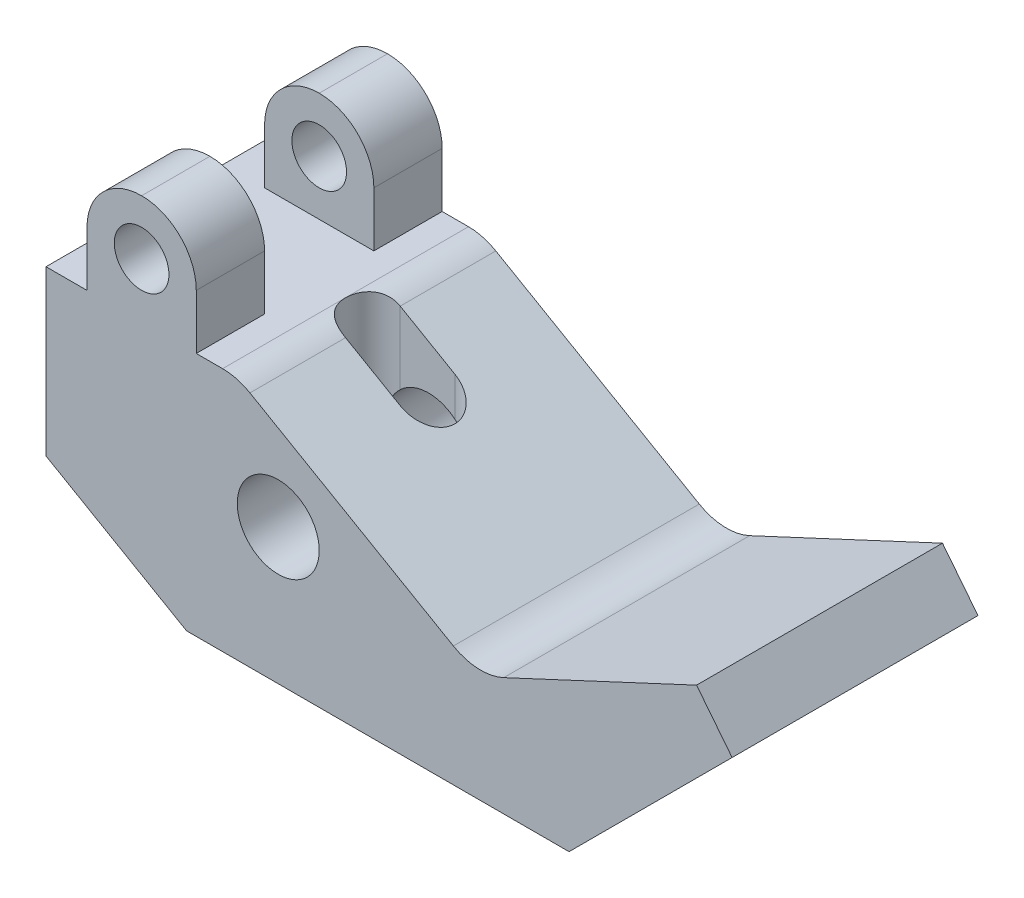
from build123d import *

# Parameters (mm, degrees)
BOSS_EXTRUDE1_DEPTH = 45
SKETCH2_W           = 20
SKETCH2_H           = 12.5
BOSS_EXTRUDE2_DEPTH = 20
FILLET1_R           = 10
FILLET2_R           = 10
SKETCH3_R           = 5
CUT_EXTRUDE1_DEPTH  = 50
CUT_EXTRUDE2_DEPTH  = 55
SKETCH5_R           = 7.5
CUT_EXTRUDE3_DEPTH  = 55


with BuildPart() as part:
    # Sketch1 → Boss-Extrude1 (new body)
    with BuildSketch(Plane.XY):
        with BuildLine():
            Line((0, 0), (70, 0))
            Line((70, 0), (99.838459525, 29.838459525))
            Line((99.838459525, 29.838459525), (93.338433206, 38.064606978))
            Line((93.338433206, 38.064606978), (58.056372922, 21.612312072))
            ThreePointArc((58.056372922, 21.612312072), (53.393996431, 20.684907727), (48.830190304, 22.015135905))
            Line((48.830190304, 22.015135905), (9.27982655, 44.849549065))
            Line((9.27982655, 44.849549065), (-25.72017345, 44.849549065))
            Line((-25.72017345, 44.849549065), (-25.72017345, 14.849549065))
            Line((-25.72017345, 14.849549065), (0, 0))
        make_face()
    extrude(amount=BOSS_EXTRUDE1_DEPTH)

    # Sketch2 → Boss-Extrude2 (add)
    with BuildSketch(Plane(origin=(0, 44.849549065, 0), x_dir=(1, 0, 0), z_dir=(0, 1, 0))):
        with Locations((-8.22017345, -6.25)):
            Rectangle(SKETCH2_W, SKETCH2_H)
        with Locations((-8.22017345, -38.75)):
            Rectangle(SKETCH2_W, SKETCH2_H)
    extrude(amount=BOSS_EXTRUDE2_DEPTH)

    # Fillet1
    fillet1_edges = [part.edges().sort_by_distance(p)[0] for p in [
        (1.77982655, 64.849549065, 38.75),
        (-18.22017345, 64.849549065, 38.75),
        (1.77982655, 64.849549065, 6.25),
        (-18.22017345, 64.849549065, 6.25),
    ]]
    fillet(fillet1_edges, radius=FILLET1_R - 0.0001)  # a hair under: the kernel refuses the full size

    # Fillet2
    fillet2_edges = [part.edges().sort_by_distance(p)[0] for p in [
        (9.27982655, 44.849549065, 22.5),
    ]]
    fillet(fillet2_edges, radius=FILLET2_R)

    # Sketch3 → Cut-Extrude1 (cut)
    with BuildSketch(Plane.XY.offset(45)):
        with Locations((-8.22017345, 54.849549065)):
            Circle(SKETCH3_R)
    extrude(amount=-CUT_EXTRUDE1_DEPTH, mode=Mode.SUBTRACT)

    # Sketch4 → Cut-Extrude2 (cut)
    with BuildSketch(Plane(origin=(0, 44.849549065, 0), x_dir=(1, 0, 0), z_dir=(0, 1, 0))):
        with BuildLine():
            Line((11.600334626, -17.5), (21.600334626, -17.5))
            ThreePointArc((21.600334626, -17.5), (26.600334626, -22.5), (21.600334626, -27.5))
            Line((21.600334626, -27.5), (11.600334626, -27.5))
            ThreePointArc((11.600334626, -27.5), (6.600334626, -22.5), (11.600334626, -17.5))
        make_face()
    extrude(amount=-CUT_EXTRUDE2_DEPTH, mode=Mode.SUBTRACT)

    # Sketch5 → Cut-Extrude3 (cut)
    with BuildSketch(Plane.XY.offset(45)):
        with Locations((16.77982655, 24.849549065)):
            Circle(SKETCH5_R)
    extrude(amount=-CUT_EXTRUDE3_DEPTH, mode=Mode.SUBTRACT)


solid = part.part
